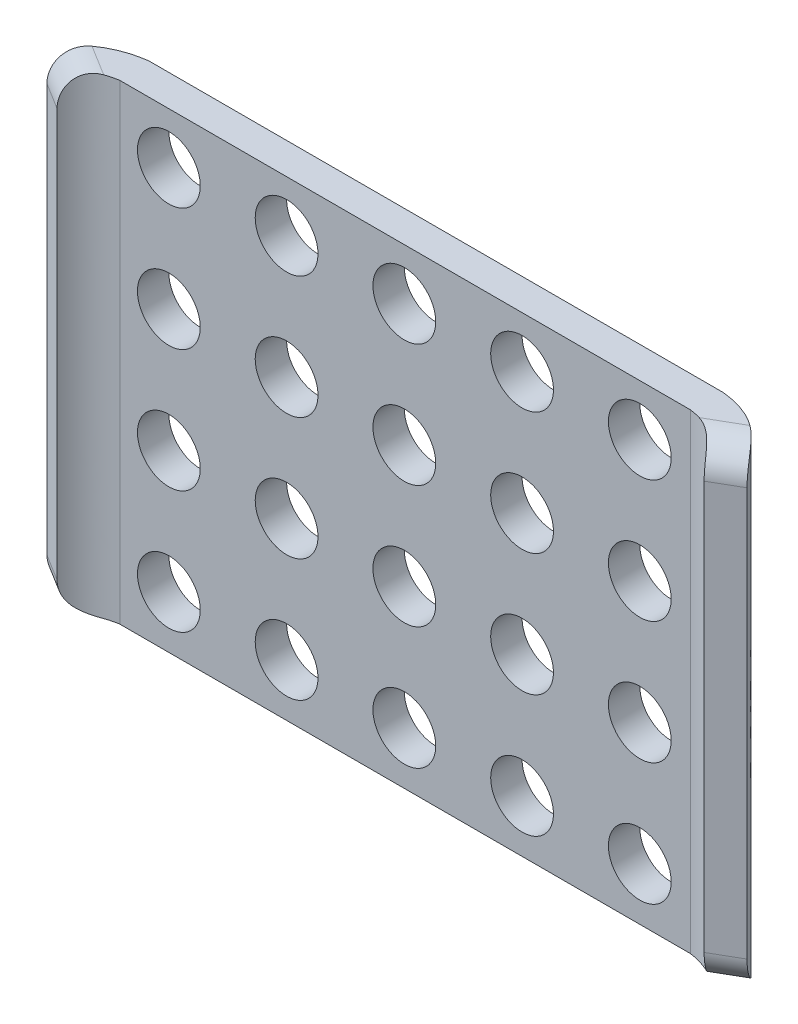
from build123d import *

# Parameters (mm, degrees)
EXTRUDE_THIN1_DEPTH  = 38.1
FILLET4_R            = 2.54
CUT_EXTRUDE1_REACH   = 49.805
SKETCH2_R            = 2.54
LPATTERN1_COUNT      = 5
LPATTERN1_PITCH      = 9.525
LPATTERN1_COUNT_DIR2 = 4
LPATTERN1_PITCH_DIR2 = 9.906


# Read off the part's stored shape, not the designer's step: Extrude-Thin1
with BuildPart() as part:
    # Extrude-Thin1 outline → Extrude-Thin1 (new body)
    with BuildSketch(Plane(origin=(0, 0, 0), x_dir=(1, 0, 0), z_dir=(0, 1, 0))):
        with BuildLine():
            Line((-22.861781044, -2.54), (23.293769416, -2.54))
            add(Edge.make_bspline(
                [(23.293769416, -2.54), (23.690788447, -2.589711931), (24.035397246, -2.670596213), (24.637666039, -2.878281595), (24.89574137, -3.004419147), (25.360322074, -3.302989633), (25.56786948, -3.475729285), (25.960337052, -3.895478718), (26.145315815, -4.143465548), (26.319262748, -4.44481044)],
                knots=[0, 0, 0, 0, 0.25, 0.25, 0.5, 0.5, 0.75, 0.75, 1, 1, 1, 1], degree=3))
            Line((26.319262748, -4.44481044), (28.519076705, -3.175))
            add(Edge.make_bspline(
                [(23.439076705, 0), (26.898166275, -0.366941984), (28.519076705, -3.175)],
                knots=[0, 0, 0, 1, 1, 1], degree=2))
            Line((23.439076705, 0), (-23.042923295, 0))
            add(Edge.make_bspline(
                [(-28.122923295, -3.175), (-26.434307868, -0.449952866), (-23.042923295, 0)],
                knots=[0, 0, 0, 1, 1, 1], degree=2))
            Line((-28.122923295, -3.175), (-25.963846277, -4.512903744))
            add(Edge.make_bspline(
                [(-25.963846277, -4.512903744), (-25.780355431, -4.216790612), (-25.585675804, -3.967832958), (-25.171704683, -3.539458263), (-24.952325189, -3.359368522), (-24.467192442, -3.046070455), (-24.200731304, -2.912638022), (-23.592393193, -2.689707924), (-23.250169649, -2.600640103), (-22.861781044, -2.54)],
                knots=[0, 0, 0, 0, 0.25, 0.25, 0.5, 0.5, 0.75, 0.75, 1, 1, 1, 1], degree=3))
        make_face()
    extrude(amount=EXTRUDE_THIN1_DEPTH)

    # Fillet4
    fillet4_edges = [part.edges().sort_by_distance(p)[0] for p in [
        (27.419169727, 38.1, 3.80990522),
        (27.419169727, 0, 3.80990522),
        (-27.043384786, 0, 3.843951872),
        (-27.043384786, 38.1, 3.843951872),
    ]]
    fillet(fillet4_edges, radius=FILLET4_R)

    # Sketch2 → Cut-Extrude1 (cut, up to next)
    with BuildSketch(Plane(origin=(0, 0, 0), x_dir=(-1, 0, 0), z_dir=(0, 0, -1)), mode=Mode.PRIVATE) as cut_extrude1_sk1:
        with Locations((18.890510813, 33.960005412)):
            Circle(SKETCH2_R)
    cut_extrude1_tool1 = extrude(cut_extrude1_sk1.sketch, amount=-CUT_EXTRUDE1_REACH, mode=Mode.PRIVATE) & part.part
    cut_extrude1 = cut_extrude1_tool1.solids().sort_by_distance((-18.890511, 33.960005, 0))[0]
    add(cut_extrude1, mode=Mode.SUBTRACT)

    # LPattern1: Cut-Extrude1 5 × 4
    with Locations(*[(i * LPATTERN1_PITCH, -j * LPATTERN1_PITCH_DIR2, 0) for i in range(LPATTERN1_COUNT) for j in range(LPATTERN1_COUNT_DIR2) if (i, j) != (0, 0)]):
        add(cut_extrude1, mode=Mode.SUBTRACT)


solid = part.part
